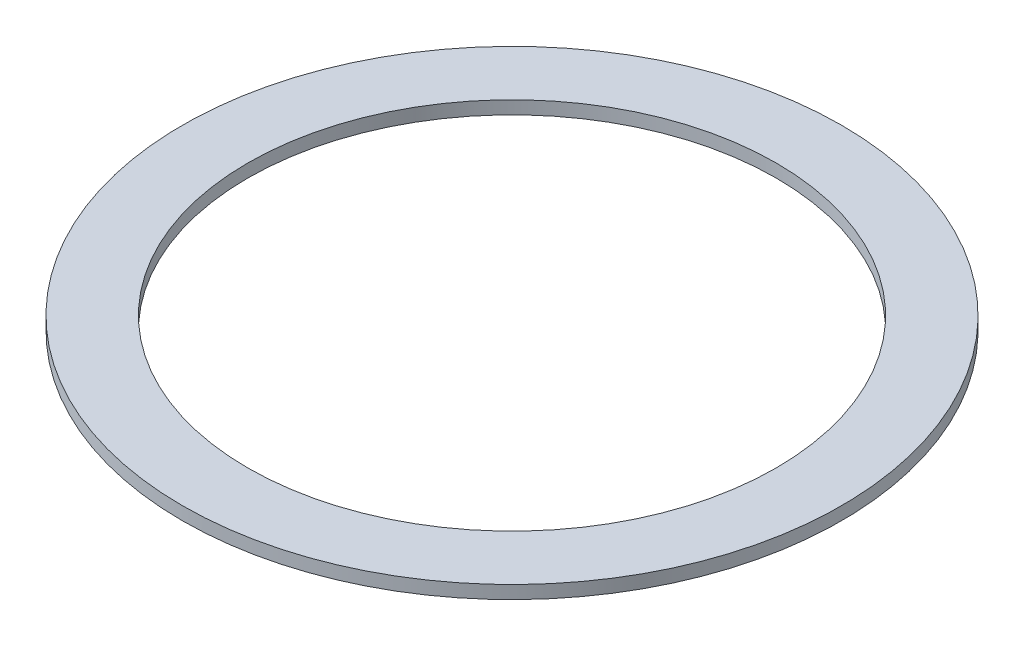
from build123d import *

# Parameters (mm, degrees)
SKETCH_1_R      = 50.4
SKETCH_1_R_2    = 40.4
EXTRUDE_1_DEPTH = 2


with BuildPart() as part:
    # 草图1 → 凸台-拉伸1 (new body)
    with BuildSketch(Plane(origin=(0, 0, 0), x_dir=(1, 0, 0), z_dir=(0, 1, 0))):
        Circle(SKETCH_1_R)
        Circle(SKETCH_1_R_2, mode=Mode.SUBTRACT)
    extrude(amount=EXTRUDE_1_DEPTH)


solid = part.part
